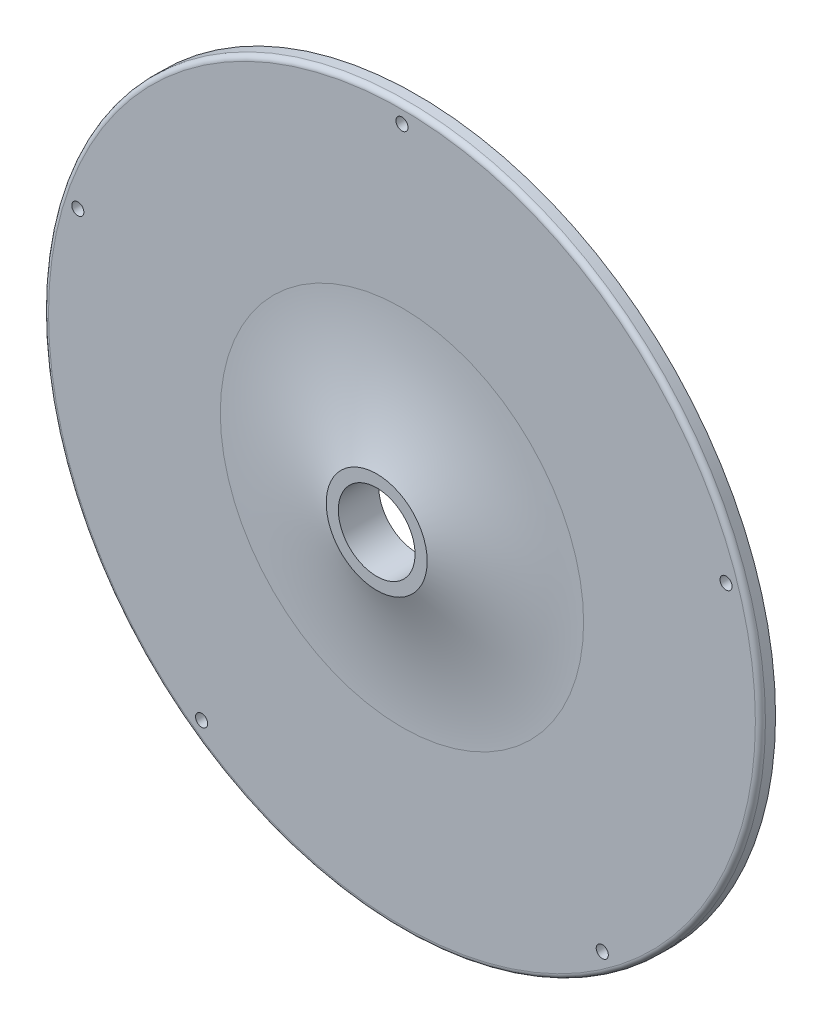
from build123d import *

# Parameters (mm, degrees)
SKETCH2_R           = 81.28
BOSS_EXTRUDE1_DEPTH = 1.27
SKETCH3_R           = 90.17
BOSS_EXTRUDE2_DEPTH = 3.81
SKETCH4_R           = 1.524
CUT_EXTRUDE2_DEPTH  = 128.576541339
CIRPATTERN1_COUNT   = 5
SKETCH14_R          = 12.7
SKETCH14_R_2        = 6.477
BOSS_EXTRUDE3_DEPTH = 6.35
SKETCH23_R          = 13.97
CUT_EXTRUDE3_DEPTH  = 1.27
SKETCH24_R          = 9.652
CUT_EXTRUDE4_DEPTH  = 128.923740564
FILLET1_R           = 88.9
FILLET2_R           = 1.27


with BuildPart() as part:
    # Sketch2 → Boss-Extrude1 (new body)
    with BuildSketch(Plane.XY):
        Circle(SKETCH2_R)
    extrude(amount=-BOSS_EXTRUDE1_DEPTH)

    # Sketch3 → Boss-Extrude2 (add)
    with BuildSketch(Plane.XY):
        with Locations(Location((0, 0, 0), (0, 0, 180))):
            Circle(SKETCH3_R)
    extrude(amount=BOSS_EXTRUDE2_DEPTH)

    # Sketch4 → Cut-Extrude2 (cut, through all)
    with BuildSketch(Plane.XY):
        with Locations(Location((0, 85.725, 0), (0, 0, 180))):
            Circle(SKETCH4_R)
    cut_extrude2 = extrude(amount=CUT_EXTRUDE2_DEPTH, mode=Mode.SUBTRACT)

    # CirPattern1: Cut-Extrude2 ×5 about axis
    cirpattern1_axis = Axis((0, 0, 0), (0, 0, 1))
    for i in range(1, CIRPATTERN1_COUNT):
        add(cut_extrude2.rotate(cirpattern1_axis, i * 360 / CIRPATTERN1_COUNT), mode=Mode.SUBTRACT)

    # Sketch14 → Boss-Extrude3 (add)
    with BuildSketch(Plane.XY.offset(3.81)):
        Circle(SKETCH14_R)
        Circle(SKETCH14_R_2, mode=Mode.SUBTRACT)
    extrude(amount=BOSS_EXTRUDE3_DEPTH)

    # Sketch23 → Cut-Extrude3 (cut)
    with BuildSketch(Plane(origin=(0, 0, -1.27), x_dir=(-1, 0, 0), z_dir=(0, 0, -1))):
        Circle(SKETCH23_R)
    extrude(amount=-CUT_EXTRUDE3_DEPTH, mode=Mode.SUBTRACT)

    # Sketch24 → Cut-Extrude4 (cut, through all)
    with BuildSketch(Plane(origin=(0, 0, 0), x_dir=(-1, 0, 0), z_dir=(0, 0, -1))):
        Circle(SKETCH24_R)
    extrude(amount=-CUT_EXTRUDE4_DEPTH, mode=Mode.SUBTRACT)

    # Fillet1
    # the kernel refuses this fillet: 88.9 mm, written as the material it adds along each edge
    with BuildSketch(Plane(origin=(0, 0, 3.81), x_dir=(1, 0, 0), z_dir=(0, -1, 0))) as fillet1_piece_1:
        with BuildLine():
            CenterArc((45.695567884, 88.9), FILLET1_R, 248.213210702, 21.786789298)
            Line((12.7, 6.35), (12.7, 0))
            Line((12.7, 0), (45.695567884, 0))
        make_face()
    revolve(axis=Axis((0, 0, 3.81), (0, 0, 1)))

    # Fillet2
    fillet2_edges = [part.edges().sort_by_distance(p)[0] for p in [
        (90.17, 0, 3.81),
    ]]
    fillet(fillet2_edges, radius=FILLET2_R)


solid = part.part
